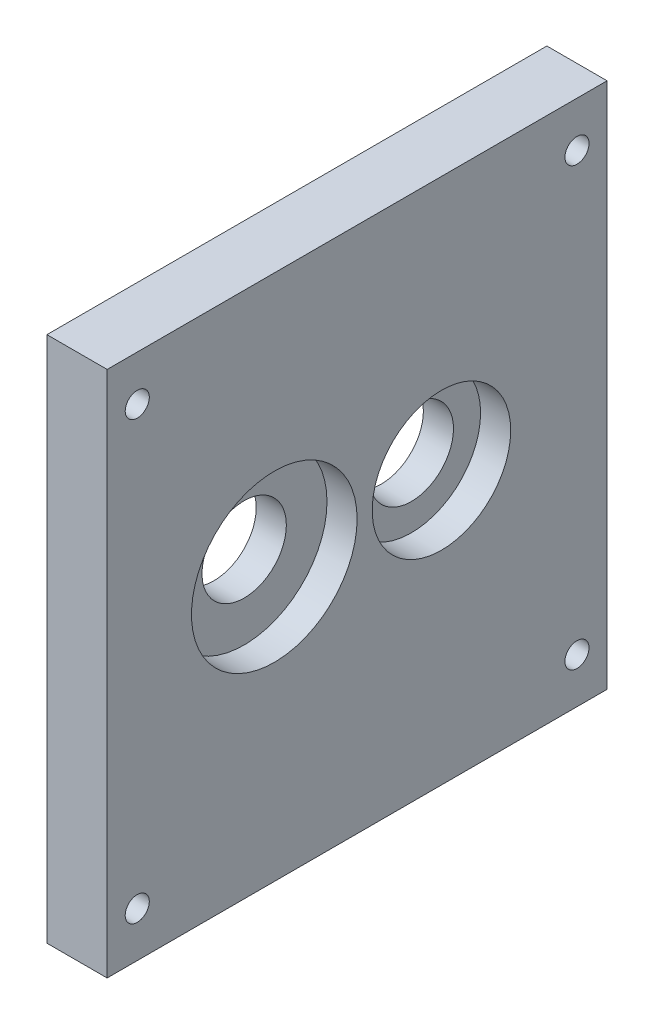
from build123d import *

# Parameters (mm, degrees)
SKETCH1_W           = 20
SKETCH1_H           = 166
BOSS_EXTRUDE1_DEPTH = 175
SKETCH2_R           = 14
CUT_EXTRUDE1_DEPTH  = 175
SKETCH3_R           = 27.5
SKETCH3_R_2         = 23
CUT_EXTRUDE2_DEPTH  = 10
SKETCH4_R           = 4
CUT_EXTRUDE3_DEPTH  = 195.715176604
SKETCH5_R           = 4
CUT_EXTRUDE4_DEPTH  = 15


with BuildPart() as part:
    # Sketch1 → Boss-Extrude1 (new body)
    with BuildSketch(Plane(origin=(0, 0, 0), x_dir=(1, 0, 0), z_dir=(0, 1, 0))):
        Rectangle(SKETCH1_W, SKETCH1_H)
    extrude(amount=BOSS_EXTRUDE1_DEPTH)

    # Sketch2 → Cut-Extrude1 (cut)
    with BuildSketch(Plane(origin=(10, 0, 0), x_dir=(0, 0, -1), z_dir=(1, 0, 0))):
        with Locations((-27.5, 90.5)):
            Circle(SKETCH2_R)
        with Locations((28, 90.5)):
            Circle(SKETCH2_R)
    extrude(amount=-CUT_EXTRUDE1_DEPTH, mode=Mode.SUBTRACT)

    # Sketch3 → Cut-Extrude2 (cut)
    with BuildSketch(Plane(origin=(10, 0, 0), x_dir=(0, 0, -1), z_dir=(1, 0, 0))):
        with Locations((-27.5, 90.5)):
            Circle(SKETCH3_R)
        with Locations((28, 90.5)):
            Circle(SKETCH3_R_2)
    extrude(amount=-CUT_EXTRUDE2_DEPTH, mode=Mode.SUBTRACT)

    # Sketch4 → Cut-Extrude3 (cut, through all)
    with BuildSketch(Plane(origin=(10, 0, 0), x_dir=(0, 0, -1), z_dir=(1, 0, 0))):
        with Locations((73, 160)):
            Circle(SKETCH4_R)
        with Locations((73, 15)):
            Circle(SKETCH4_R)
        with Locations((-73, 15)):
            Circle(SKETCH4_R)
        with Locations((-73, 160)):
            Circle(SKETCH4_R)
    extrude(amount=-CUT_EXTRUDE3_DEPTH, mode=Mode.SUBTRACT)

    # Sketch5 → Cut-Extrude4 (cut)
    with BuildSketch(Plane.XZ):
        with Locations((0, -50)):
            Circle(SKETCH5_R)
        with Locations((0, 50)):
            Circle(SKETCH5_R)
    extrude(amount=-CUT_EXTRUDE4_DEPTH, mode=Mode.SUBTRACT)


solid = part.part
